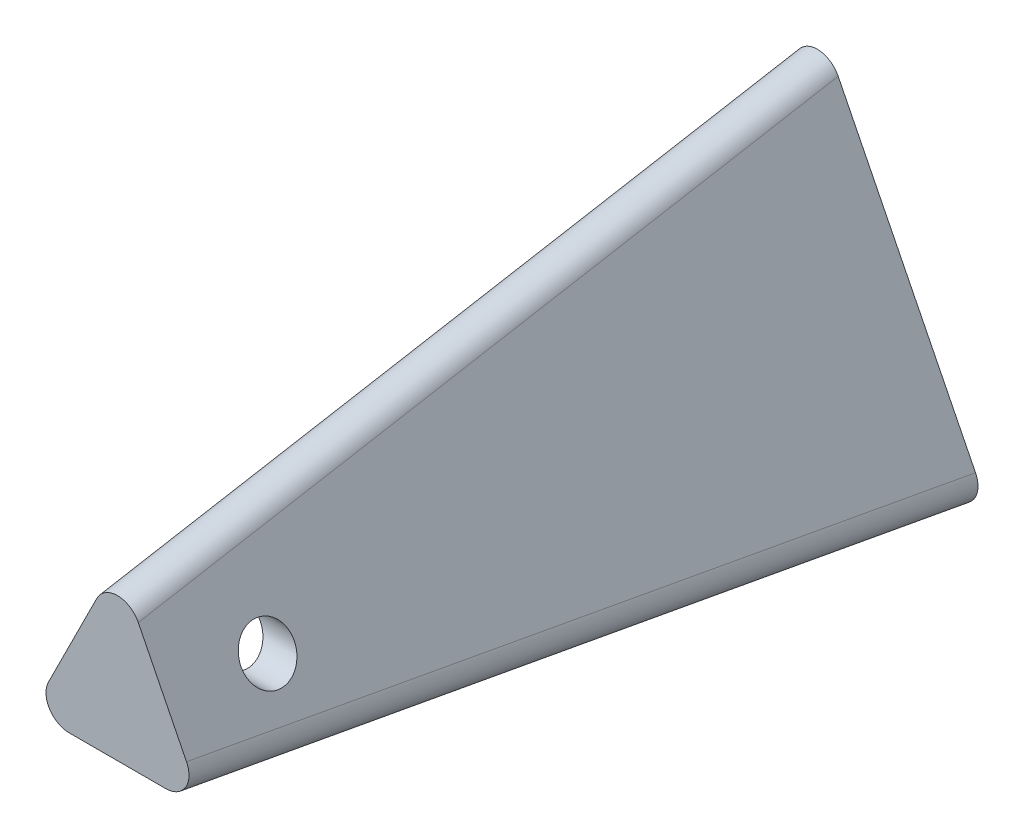
from build123d import *

# Parameters (mm, degrees)
BOSS_EXTRUDE1_DEPTH = 76.2
BOSS_EXTRUDE1_TAPER = 4.5
SHELL1_T            = -3.302
SKETCH3_R           = 2.667
CUT_EXTRUDE1_DEPTH  = 94.3255592
FILLET1_R           = 2.54


with BuildPart() as part:
    # Sketch1 → Boss-Extrude1 (new body)
    with BuildSketch(Plane.XY):
        Polygon((19.05, 38.1), (0, 0), (38.1, 0), align=None)
    extrude(amount=BOSS_EXTRUDE1_DEPTH, taper=BOSS_EXTRUDE1_TAPER)

    # Shell1
    shell1_openings = [part.faces().sort_by_distance(p)[0] for p in [
        (19.05, 2.656988988, 33.76024606),
    ]]
    offset(amount=SHELL1_T, openings=shell1_openings, kind=Kind.INTERSECTION)

    # Sketch3 → Cut-Extrude1 (cut, through all)
    with BuildSketch(Plane(origin=(0, 0, 0), x_dir=(0, 0, -1), z_dir=(1, 0, 0))):
        with Locations(Location((-66.04, 14.114950363, 0), (0, 0, 279.98084931))):
            Circle(SKETCH3_R)
    extrude(amount=CUT_EXTRUDE1_DEPTH, mode=Mode.SUBTRACT)

    # Fillet1
    # the kernel refuses this fillet: 2.54 mm, written as the material it takes off along each edge
    with BuildSketch(Plane(origin=(39.379699759, -0.790897947, -10.049311237), x_dir=(-0.9920380235210648, -0.00988103768125179, -0.12555048778384248), z_dir=(-0.12593871481168567, 0.07783440625310155, 0.9889799013705022)), Plane(origin=(-1.279699759, -0.790897947, -10.049311237), x_dir=(0.43481502259412097, 0.8917247171317577, -0.1255504877838424), z_dir=(0.1259387148116856, 0.07783440625310152, 0.9889799013705022))) as fillet1_piece_1:
        with BuildLine():
            CenterArc((FILLET1_R * 1.60020309461, -FILLET1_R), FILLET1_R, 90, 115.995770326)
            Line((FILLET1_R * 0.701376689441, -FILLET1_R * 1.43830479506), (0, 0))
            Line((0, 0), (FILLET1_R * 1.60020309461, 0))
        make_face()
    extrude(amount=97.371667857, mode=Mode.SUBTRACT)
    with BuildSketch(Plane(origin=(19.05, 40.267836366, -12.318486277), x_dir=(-0.45268605430468506, -0.8781752040708111, -0.1545433505306691), z_dir=(0, -0.1733190032733758, 0.9848657386183782))) as fillet1_piece_2:
        with BuildLine():
            CenterArc((FILLET1_R * 1.96973147724, FILLET1_R), FILLET1_R, 143.832298895, 126.167701105)
            Line((FILLET1_R * 1.16243835589, FILLET1_R * 1.59015067248), (0, 0))
            Line((0, 0), (FILLET1_R * 1.96973147724, 0))
        make_face()
    extrude(amount=102.386529419, mode=Mode.SUBTRACT)


solid = part.part
